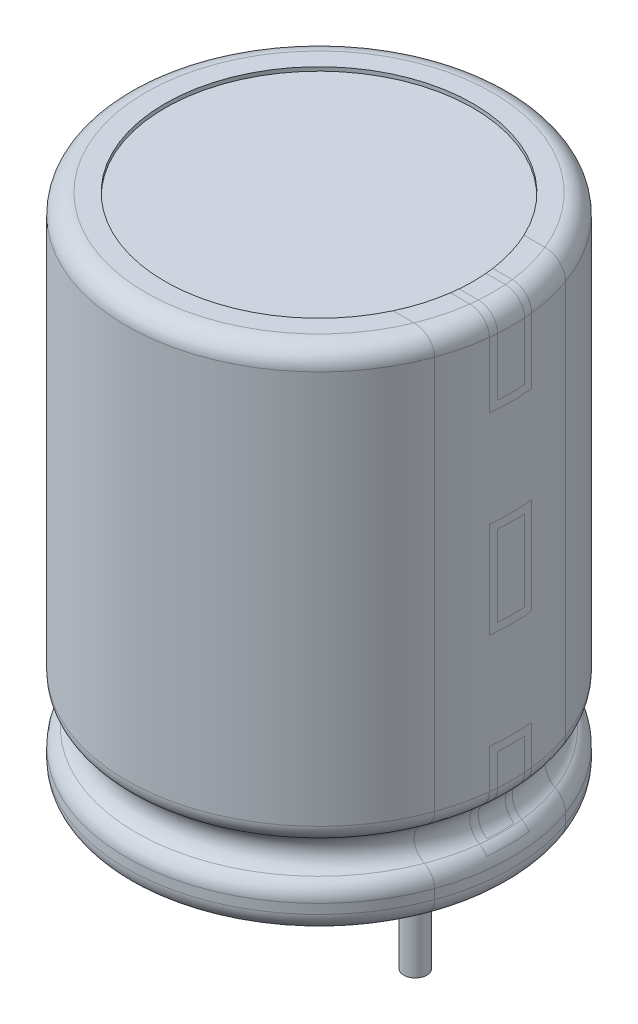
from build123d import *

# Parameters (mm, degrees)
BOSS_EXTRUDE1_DEPTH        = 1
BOSS_EXTRUDE1_DEPTH_BACK   = 3
SKETCH1_R                  = 0.3
BOSS_EXTRUDE1_2_DEPTH      = 1
BOSS_EXTRUDE1_2_DEPTH_BACK = 3


with BuildPart() as part:
    # Sketch1 → Boss-Extrude1 (new, two sides: drawn at the far end of the back side and taken through both)
    with BuildSketch(Plane(origin=(0, 0, 0), x_dir=(1, 0, 0), z_dir=(0, 1, 0)).offset(-BOSS_EXTRUDE1_DEPTH_BACK)):
        with Locations((-2.5, 0)):
            Circle(SKETCH1_R)
    extrude(amount=BOSS_EXTRUDE1_DEPTH + BOSS_EXTRUDE1_DEPTH_BACK)



with BuildPart() as body_2:
    # Sketch1 → Boss-Extrude1 2 (new, two sides: drawn at the far end of the back side and taken through both)
    with BuildSketch(Plane(origin=(0, 0, 0), x_dir=(1, 0, 0), z_dir=(0, 1, 0)).offset(-BOSS_EXTRUDE1_2_DEPTH_BACK)):
        with Locations((2.5, 0)):
            Circle(SKETCH1_R)
    extrude(amount=BOSS_EXTRUDE1_2_DEPTH + BOSS_EXTRUDE1_2_DEPTH_BACK)


with BuildPart() as part_1:
    add(part.part)

    add(body_2.part)  # Revolve1 merges body 2
    # Sketch3 → Revolve1 (revolve)
    with BuildSketch(Plane.XY):
        with BuildLine():
            Line((5, 0.5), (5, 0.75))
            ThreePointArc((5, 0.75), (4.933012702, 1), (4.75, 1.183012702))
            ThreePointArc((4.75, 1.183012702), (4.5, 1.616025404), (4.75, 2.049038106))
            ThreePointArc((4.75, 2.049038106), (4.933012702, 2.232050808), (5, 2.482050808))
            Line((5, 2.482050808), (5, 12.7))
            ThreePointArc((5, 12.7), (4.853553391, 13.053553391), (4.5, 13.2))
            Line((4.5, 13.2), (4, 13.2))
            Line((4, 13.2), (4, 13.1))
            Line((4, 13.1), (0, 13.1))
            Line((0, 13.1), (0, 0.1))
            Line((0, 0.1), (4, 0.1))
            Line((4, 0.1), (4, 0))
            Line((4, 0), (4.5, 0))
            ThreePointArc((4.5, 0), (4.853553391, 0.146446609), (5, 0.5))
        make_face()
    revolve(axis=Axis((0, 0.1, 0), (0, 1, 0)))


solid = part_1.part
